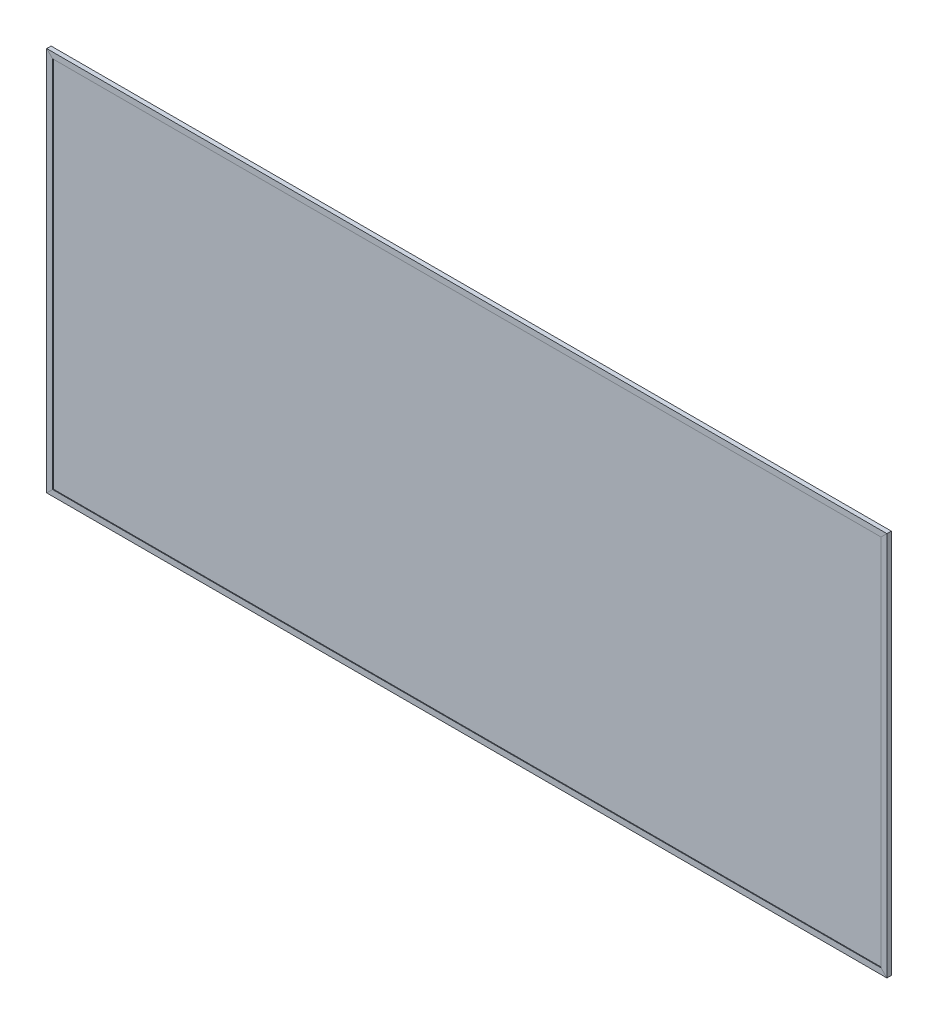
from build123d import *

# Parameters (mm, degrees)
SKETCH2_W                     = 1816.1
SKETCH2_H                     = 831.85
FRAME_OUTER_DIMENSIONS_DEPTH  = 4.7625
SKETCH3_W                     = 1790.7
SKETCH3_H                     = 806.45
FRAME_INNER_DIMENSIONS_DEPTH  = 1198.783215204
CUT_EXTRUDE2_DEPTH            = 3.175
CUT_EXTRUDE2_DEPTH_BACK       = 3.175
SKETCH4_W                     = 1812.925
SKETCH4_H                     = 828.675
FRAME_START                   = -4.7625
FRAME_SECTIONS_SPLIT_DEPTH    = 9.525
FRAME_SECTIONS_SPLIT_2_DEPTH  = 1.5875
FRAME_START_2                 = 3.175
FRAME_SECTIONS_SPLIT_3_DEPTH  = 1.5875
FRAME_START_3                 = -3.175
FRAME_SECTIONS_SPLIT_4_DEPTH  = 6.35
FRAME_SECTIONS_SPLIT_5_DEPTH  = 1.5875
FRAME_SECTIONS_SPLIT_6_DEPTH  = 1.5875
FRAME_SECTIONS_SPLIT_7_DEPTH  = 6.35
FRAME_SECTIONS_SPLIT_8_DEPTH  = 1.5875
FRAME_SECTIONS_SPLIT_9_DEPTH  = 1.5875
FRAME_SECTIONS_SPLIT_10_DEPTH = 6.35
SKETCH6_W                     = 1809.75
SKETCH6_H                     = 825.5
DOOR_PANEL_DEPTH              = 2.794


# Read off the part's stored shape, not the designer's step: Frame sections split
with BuildPart() as part:
    # Sketch2 → Frame outer dimensions (new, symmetric)
    with BuildSketch(Plane.XY):
        with Locations((0, 365.125)):
            Rectangle(SKETCH2_W, SKETCH2_H)
    extrude(amount=FRAME_OUTER_DIMENSIONS_DEPTH, both=True)

    # Sketch3 → Frame inner dimensions (cut, through all)
    with BuildSketch(Plane.XY.offset(4.7625)):
        with Locations((0, 365.125)):
            Rectangle(SKETCH3_W, SKETCH3_H)
    extrude(amount=-FRAME_INNER_DIMENSIONS_DEPTH, mode=Mode.SUBTRACT)

    # Sketch4 → Cut-Extrude2 (cut, two sides: drawn at the far end of the back side and taken through both)
    with BuildSketch(Plane.XY.offset(-CUT_EXTRUDE2_DEPTH_BACK)):
        with Locations((0, 365.125)):
            Rectangle(SKETCH4_W, SKETCH4_H)
    extrude(amount=CUT_EXTRUDE2_DEPTH + CUT_EXTRUDE2_DEPTH_BACK, mode=Mode.SUBTRACT)

    # Frame sections split outline → Frame sections split (cut)
    with BuildSketch(Plane.XY.offset(FRAME_START)):
        Polygon((895.35, 768.35), (895.35, -38.1), (-895.35, -38.1), (-895.35, 768.35), (-908.05, 781.05), (-908.05, -50.8), (908.05, -50.8), (908.05, 781.05), align=None)
    extrude(amount=FRAME_SECTIONS_SPLIT_DEPTH, mode=Mode.SUBTRACT)


with BuildPart() as body_2:
    # Frame sections split 2 outline → Frame sections split 2 (new body)
    with BuildSketch(Plane.XY.offset(FRAME_START)):
        Polygon((895.35, 768.35), (895.35, -38.1), (908.05, -50.8), (908.05, 781.05), align=None)
    extrude(amount=FRAME_SECTIONS_SPLIT_2_DEPTH)

    # Frame sections split 3 outline → Frame sections split 3 (add)
    with BuildSketch(Plane.XY.offset(FRAME_START_2)):
        Polygon((895.35, 768.35), (895.35, -38.1), (908.05, -50.8), (908.05, 781.05), align=None)
    extrude(amount=FRAME_SECTIONS_SPLIT_3_DEPTH)

    # Frame sections split 4 outline → Frame sections split 4 (add)
    with BuildSketch(Plane.XY.offset(FRAME_START_3)):
        Polygon((908.05, 781.05), (906.4625, 779.4625), (906.4625, -49.2125), (908.05, -50.8), align=None)
    extrude(amount=FRAME_SECTIONS_SPLIT_4_DEPTH)


with BuildPart() as body_3:
    # Frame sections split 5 outline → Frame sections split 5 (new body)
    with BuildSketch(Plane.XY.offset(FRAME_START)):
        Polygon((-895.35, -38.1), (-895.35, 768.35), (-908.05, 781.05), (-908.05, -50.8), align=None)
    extrude(amount=FRAME_SECTIONS_SPLIT_5_DEPTH)

    # Frame sections split 6 outline → Frame sections split 6 (add)
    with BuildSketch(Plane.XY.offset(FRAME_START_2)):
        Polygon((-895.35, -38.1), (-895.35, 768.35), (-908.05, 781.05), (-908.05, -50.8), align=None)
    extrude(amount=FRAME_SECTIONS_SPLIT_6_DEPTH)

    # Frame sections split 7 outline → Frame sections split 7 (add)
    with BuildSketch(Plane.XY.offset(FRAME_START_3)):
        Polygon((-908.05, -50.8), (-906.4625, -49.2125), (-906.4625, 779.4625), (-908.05, 781.05), align=None)
    extrude(amount=FRAME_SECTIONS_SPLIT_7_DEPTH)


with BuildPart() as body_4:
    # Frame sections split 8 outline → Frame sections split 8 (new body)
    with BuildSketch(Plane.XY.offset(FRAME_START)):
        Polygon((895.35, -38.1), (-895.35, -38.1), (-908.05, -50.8), (908.05, -50.8), align=None)
    extrude(amount=FRAME_SECTIONS_SPLIT_8_DEPTH)

    # Frame sections split 9 outline → Frame sections split 9 (add)
    with BuildSketch(Plane.XY.offset(FRAME_START_2)):
        Polygon((895.35, -38.1), (-895.35, -38.1), (-908.05, -50.8), (908.05, -50.8), align=None)
    extrude(amount=FRAME_SECTIONS_SPLIT_9_DEPTH)

    # Frame sections split 10 outline → Frame sections split 10 (add)
    with BuildSketch(Plane.XY.offset(FRAME_START_3)):
        Polygon((908.05, -50.8), (906.4625, -49.2125), (-906.4625, -49.2125), (-908.05, -50.8), align=None)
    extrude(amount=FRAME_SECTIONS_SPLIT_10_DEPTH)


with BuildPart() as body_5:
    # Sketch6 → Door panel (new, symmetric)
    with BuildSketch(Plane.XY):
        with Locations((0, 365.125)):
            Rectangle(SKETCH6_W, SKETCH6_H)
    extrude(amount=DOOR_PANEL_DEPTH, both=True)


solid = Compound([part.part, body_2.part, body_3.part, body_4.part, body_5.part])
